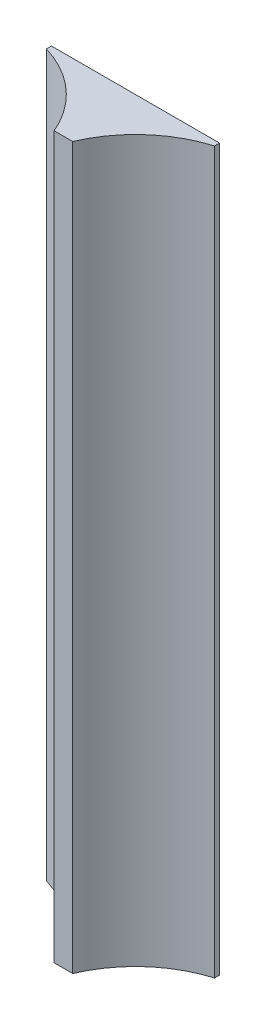
from build123d import *

# Parameters (mm, degrees)
BOSS_EXTRUDE1_DEPTH = 60


with BuildPart() as part:
    # Sketch1 → Boss-Extrude1 (new body)
    with BuildSketch(Plane(origin=(0, 0, 0), x_dir=(1, 0, 0), z_dir=(0, 1, 0))):
        with BuildLine():
            Line((-0.775138123, 0), (0.775138123, 0))
            ThreePointArc((0.775138123, 0), (3.263641579, 3.487947468), (7, 5.585100956))
            Line((7, 5.585100956), (7, 6))
            Line((7, 6), (-7, 6))
            Line((-7, 6), (-7, 5.585100956))
            ThreePointArc((-7, 5.585100956), (-3.263641579, 3.487947468), (-0.775138123, 0))
        make_face()
    extrude(amount=BOSS_EXTRUDE1_DEPTH)


solid = part.part
